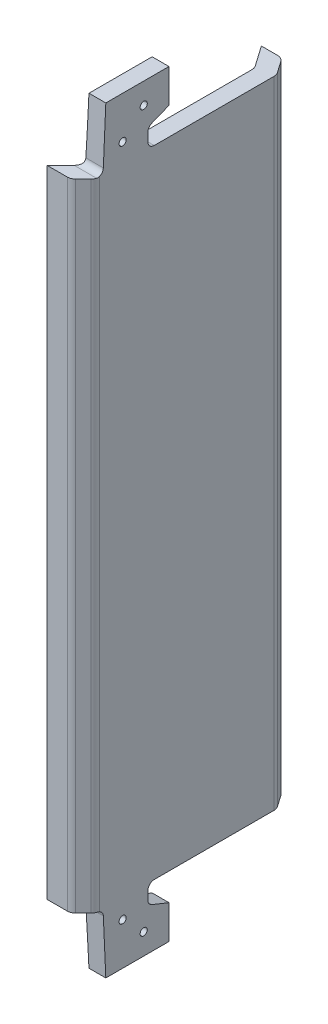
from build123d import *

# Parameters (mm, degrees)
BOSS_EXTRUDE1_DEPTH = 95.885
BOSS_EXTRUDE2_DEPTH = 5.08
SKETCH5_R           = 1.0795
CUT_EXTRUDE1_DEPTH  = 130.08277933
FILLET2_R           = 1.905
FILLET3_R           = 2.54


with BuildPart() as part:
    # Sketch2 → Boss-Extrude1 (new, symmetric)
    with BuildSketch(Plane(origin=(0, 0, 0), x_dir=(1, 0, 0), z_dir=(0, 1, 0))):
        Polygon((0, 0), (-3.81, -3.81), (-10.994204897, -3.81), (-5.08, 2.104204897), (-5.08, 52.904204897), (-9.831464884, 59.69), (-3.629929973, 59.69), (0, 54.505922744), align=None)
    extrude(amount=BOSS_EXTRUDE1_DEPTH, both=True)

    # Sketch3 → Boss-Extrude2 (add)
    with BuildSketch(Plane.ZY.offset(5.08)):
        Polygon((-15.638409794, -95.885), (-15.638409794, -101.6), (-21.988409794, -104.14), (-21.988409794, -114.3), (-2.938409794, -114.3), (-2.104204897, -95.885), align=None)
        Polygon((-15.638409794, 95.885), (-2.104204897, 95.885), (-2.938409794, 114.3), (-21.988409794, 114.3), (-21.988409794, 104.14), (-15.638409794, 101.6), align=None)
    extrude(amount=-BOSS_EXTRUDE2_DEPTH)

    # Sketch5 → Cut-Extrude1 (cut, through all)
    with BuildSketch(Plane.ZY.offset(5.08)):
        with Locations((-40.64, -107.95)):
            Circle(SKETCH5_R)
        with Locations((-46.99, -101.6)):
            Circle(SKETCH5_R)
        with Locations((-46.99, 101.6)):
            Circle(SKETCH5_R)
        with Locations((-40.64, 107.95)):
            Circle(SKETCH5_R)
        with Locations((-8.018409794, -101.6)):
            Circle(SKETCH5_R)
        with Locations((-14.368409794, -107.95)):
            Circle(SKETCH5_R)
        with Locations((-8.018409794, 101.6)):
            Circle(SKETCH5_R)
        with Locations((-14.368409794, 107.95)):
            Circle(SKETCH5_R)
    extrude(amount=-CUT_EXTRUDE1_DEPTH, mode=Mode.SUBTRACT)

    # Fillet2
    # the kernel refuses this fillet: 1.905 mm, written as the material it adds along each edge
    with BuildSketch(Plane(origin=(-5.08, -95.885, -15.638409794), x_dir=(0, 0, -1), z_dir=(1, 0, 0))) as fillet2_piece_1:
        with BuildLine():
            CenterArc((FILLET2_R, -FILLET2_R), FILLET2_R, 90, 90)
            Line((0, -FILLET2_R), (0, 0))
            Line((0, 0), (FILLET2_R, 0))
        make_face()
    extrude(amount=5.08)
    with BuildSketch(Plane(origin=(-5.08, -95.885, -2.104204897), x_dir=(0, 0, 1), z_dir=(1, 0, 0))) as fillet2_piece_2_section:
        with BuildLine():
            CenterArc((FILLET2_R * 0.955725239349, FILLET2_R), FILLET2_R, 182.593742353, 87.406257647)
            Line((-FILLET2_R * 0.0432502788724, FILLET2_R * 0.954746116256), (0, 0))
            Line((0, 0), (FILLET2_R * 0.955725239349, 0))
        make_face()
    fillet2_piece_2 = extrude(amount=5.08, mode=Mode.PRIVATE)
    fillet2_piece_2 = split(fillet2_piece_2, bisect_by=Plane(origin=(-5.032232027, -97.010068738, -2.15197287), z_dir=(-0.7071067811865467, 0, -0.7071067811865485)), keep=Keep.TOP, mode=Mode.PRIVATE)
    add(fillet2_piece_2)
    with BuildSketch(Plane(origin=(-9.631641452, -95.885, -2.104204897), x_dir=(0, 0, 1), z_dir=(1, 0, 0))) as fillet2_piece_3_section:
        with BuildLine():
            CenterArc((FILLET2_R * 0.955725239349, FILLET2_R), FILLET2_R, 182.593742353, 87.406257647)
            Line((-FILLET2_R * 0.0432502788724, FILLET2_R * 0.954746116256), (0, 0))
            Line((0, 0), (FILLET2_R * 0.955725239349, 0))
        make_face()
    fillet2_piece_3 = extrude(amount=9.631641452, mode=Mode.PRIVATE)
    fillet2_piece_3 = split(fillet2_piece_3, bisect_by=Plane(origin=(-5.677063574, -96.058379599, -1.507141323), z_dir=(0.7071067811865467, 0, 0.7071067811865485)), keep=Keep.TOP, mode=Mode.PRIVATE)
    fillet2_piece_3 = split(fillet2_piece_3, bisect_by=Plane(origin=(-5.08, -96.058379599, -1.308120132), z_dir=(-1, 0, 0)), keep=Keep.TOP, mode=Mode.PRIVATE)
    add(fillet2_piece_3)
    with BuildSketch(Plane(origin=(-5.08, -95.885, -2.104204897), x_dir=(0, 0, 1), z_dir=(1, 0, 0))) as fillet2_piece_4_section:
        with BuildLine():
            CenterArc((FILLET2_R * 0.955725239349, FILLET2_R), FILLET2_R, 182.593742353, 87.406257647)
            Line((-FILLET2_R * 0.0432502788724, FILLET2_R * 0.954746116256), (0, 0))
            Line((0, 0), (FILLET2_R * 0.955725239349, 0))
        make_face()
    fillet2_piece_4 = extrude(amount=5.08, mode=Mode.PRIVATE)
    fillet2_piece_4 = split(fillet2_piece_4, bisect_by=Plane(origin=(-4.004458977, -96.293780551, -3.17974592), z_dir=(0.7071067811865467, 0, 0.7071067811865485)), keep=Keep.TOP, mode=Mode.PRIVATE)
    add(fillet2_piece_4)
    with BuildSketch(Plane(origin=(-5.08, -101.6, -15.638409794), x_dir=(0, 1, 0), z_dir=(1, 0, 0))) as fillet2_piece_5:
        with BuildLine():
            CenterArc((FILLET2_R * 0.677032961427, -FILLET2_R), FILLET2_R, 90, 68.198590514)
            Line((-FILLET2_R * 0.251443729458, -FILLET2_R * 0.628609323646), (0, 0))
            Line((0, 0), (FILLET2_R * 0.677032961427, 0))
        make_face()
    extrude(amount=5.08)
    with BuildSketch(Plane(origin=(-5.08, 95.885, -15.638409794), x_dir=(0, 0, -1), z_dir=(1, 0, 0))) as fillet2_piece_6:
        with BuildLine():
            CenterArc((FILLET2_R, FILLET2_R), FILLET2_R, 180, 90)
            Line((0, FILLET2_R), (0, 0))
            Line((0, 0), (FILLET2_R, 0))
        make_face()
    extrude(amount=5.08)
    with BuildSketch(Plane(origin=(-5.08, 101.6, -15.638409794), x_dir=(0, -1, 0), z_dir=(1, 0, 0))) as fillet2_piece_7:
        with BuildLine():
            CenterArc((FILLET2_R * 0.677032961427, FILLET2_R), FILLET2_R, 201.801409486, 68.198590514)
            Line((-FILLET2_R * 0.251443729458, FILLET2_R * 0.628609323646), (0, 0))
            Line((0, 0), (FILLET2_R * 0.677032961427, 0))
        make_face()
    extrude(amount=5.08)
    with BuildSketch(Plane(origin=(-5.08, 95.885, -2.104204897), x_dir=(0, 0, 1), z_dir=(1, 0, 0))) as fillet2_piece_8_section:
        with BuildLine():
            CenterArc((FILLET2_R * 0.955725239349, -FILLET2_R), FILLET2_R, 90, 87.406257647)
            Line((-FILLET2_R * 0.0432502788724, -FILLET2_R * 0.954746116256), (0, 0))
            Line((0, 0), (FILLET2_R * 0.955725239349, 0))
        make_face()
    fillet2_piece_8 = extrude(amount=5.08, mode=Mode.PRIVATE)
    fillet2_piece_8 = split(fillet2_piece_8, bisect_by=Plane(origin=(-5.032232027, 97.010068738, -2.15197287), z_dir=(-0.7071067811865467, 0, -0.7071067811865485)), keep=Keep.TOP, mode=Mode.PRIVATE)
    add(fillet2_piece_8)
    with BuildSketch(Plane(origin=(-9.631641452, 95.885, -2.104204897), x_dir=(0, 0, 1), z_dir=(1, 0, 0))) as fillet2_piece_9_section:
        with BuildLine():
            CenterArc((FILLET2_R * 0.955725239349, -FILLET2_R), FILLET2_R, 90, 87.406257647)
            Line((-FILLET2_R * 0.0432502788724, -FILLET2_R * 0.954746116256), (0, 0))
            Line((0, 0), (FILLET2_R * 0.955725239349, 0))
        make_face()
    fillet2_piece_9 = extrude(amount=9.631641452, mode=Mode.PRIVATE)
    fillet2_piece_9 = split(fillet2_piece_9, bisect_by=Plane(origin=(-5.677063574, 96.058379599, -1.507141323), z_dir=(0.7071067811865467, 0, 0.7071067811865485)), keep=Keep.TOP, mode=Mode.PRIVATE)
    fillet2_piece_9 = split(fillet2_piece_9, bisect_by=Plane(origin=(-5.08, 96.058379599, -1.308120132), z_dir=(-1, 0, 0)), keep=Keep.TOP, mode=Mode.PRIVATE)
    add(fillet2_piece_9)
    with BuildSketch(Plane(origin=(-5.08, 95.885, -2.104204897), x_dir=(0, 0, 1), z_dir=(1, 0, 0))) as fillet2_piece_10_section:
        with BuildLine():
            CenterArc((FILLET2_R * 0.955725239349, -FILLET2_R), FILLET2_R, 90, 87.406257647)
            Line((-FILLET2_R * 0.0432502788724, -FILLET2_R * 0.954746116256), (0, 0))
            Line((0, 0), (FILLET2_R * 0.955725239349, 0))
        make_face()
    fillet2_piece_10 = extrude(amount=5.08, mode=Mode.PRIVATE)
    fillet2_piece_10 = split(fillet2_piece_10, bisect_by=Plane(origin=(-4.004458977, 96.293780551, -3.17974592), z_dir=(0.7071067811865467, 0, 0.7071067811865485)), keep=Keep.TOP, mode=Mode.PRIVATE)
    add(fillet2_piece_10)

    # Fillet3
    fillet3_edges = [part.edges().sort_by_distance(p)[0] for p in [
        (-3.629929973, 0, -59.69),
        (-3.81, 0, 3.81),
        (0, 0, -54.505922744),
        (0, 0, 0),
        (-5.08, 0, -52.904204897),
        (-5.08, 0, -2.104204897),
    ]]
    fillet(fillet3_edges, radius=FILLET3_R)


solid = part.part
